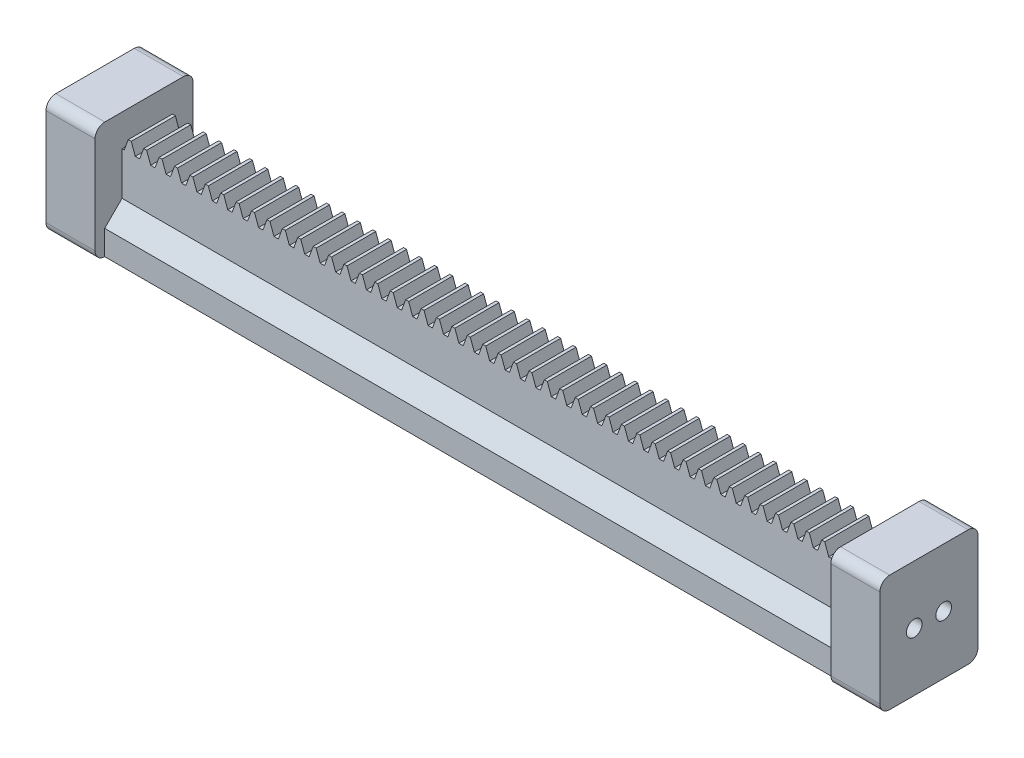
from build123d import *

# Parameters (mm, degrees)
BLANKSKE_W          = 150
BLANKSKE_H          = 11
BLANK_DEPTH         = 9
TOOTHCUTSIM_DEPTH   = 151.67182882
TEETHCUTS_COUNT     = 49
TEETHCUTS_PITCH     = 3.14159265
BOSS_EXTRUDE4_DEPTH = 150
BOSS_EXTRUDE5_DEPTH = 10
SKETCH6_R           = 1.6
CUT_EXTRUDE1_DEPTH  = 10


with BuildPart() as part:
    # BlankSke → Blank (new body)
    with BuildSketch(Plane.XY):
        with Locations((75, 5.5)):
            Rectangle(BLANKSKE_W, BLANKSKE_H)
    extrude(amount=-BLANK_DEPTH)

    # TooCutSkeSim → ToothCutSim (cut, through all)
    with BuildSketch(Plane.XY):
        Polygon((0.44443537, 8.75), (-0.44443537, 8.75), (-1.272613241, 11.0254), (1.272613241, 11.0254), align=None)
    toothcutsim = extrude(amount=-TOOTHCUTSIM_DEPTH, mode=Mode.SUBTRACT)

    # TeethCuts: ToothCutSim ×49
    with Locations(*[(i * TEETHCUTS_PITCH, 0, 0) for i in range(1, TEETHCUTS_COUNT)]):
        add(toothcutsim, mode=Mode.SUBTRACT)

    # Sketch4 → Boss-Extrude4 (add, through all)
    with BuildSketch(Plane(origin=(150, 0, 0), x_dir=(0, 0, -1), z_dir=(1, 0, 0))):
        Polygon((0, 0), (-3.535533906, -3.535533906), (-3.535533906, -8.535533906), (12.535533906, -8.535533906), (12.535533906, -3.535533906), (9, 0), align=None)
    extrude(amount=-BOSS_EXTRUDE4_DEPTH)

    # Sketch5 → Boss-Extrude5 (add)
    with BuildSketch(Plane(origin=(150, 0, 0), x_dir=(0, 0, -1), z_dir=(1, 0, 0))):
        with BuildLine():
            Line((12.5, -8.535533906), (-3.5, -8.535533906))
            ThreePointArc((-3.5, -8.535533906), (-4.914213562, -7.949747468), (-5.5, -6.535533906))
            Line((-5.5, -6.535533906), (-5.5, 13.232233047))
            ThreePointArc((-5.5, 13.232233047), (-4.914213562, 14.646446609), (-3.5, 15.232233047))
            Line((-3.5, 15.232233047), (12.5, 15.232233047))
            ThreePointArc((12.5, 15.232233047), (13.914213562, 14.646446609), (14.5, 13.232233047))
            Line((14.5, 13.232233047), (14.5, -6.535533906))
            ThreePointArc((14.5, -6.535533906), (13.914213562, -7.949747468), (12.5, -8.535533906))
        make_face()
    boss_extrude5 = extrude(amount=BOSS_EXTRUDE5_DEPTH)

    # Mirror2: Boss-Extrude5 across plane
    add(boss_extrude5.mirror(Plane(origin=(75, 0, 0), x_dir=(0, 0, 1), z_dir=(1, 0, 0))))

    # Sketch6 → Cut-Extrude1 (cut)
    with BuildSketch(Plane(origin=(160, 0, 0), x_dir=(0, 0, -1), z_dir=(1, 0, 0))):
        with Locations((1.5, 3.348349571)):
            Circle(SKETCH6_R)
        with Locations((7.5, 3.348349571)):
            Circle(SKETCH6_R)
    extrude(amount=-CUT_EXTRUDE1_DEPTH, mode=Mode.SUBTRACT)


with BuildPart() as body_2:
    # Split1: the piece on the far side of the plane
    add(part.part)
    split(bisect_by=Plane(origin=(0, 0, 0), x_dir=(0, 0, 1), z_dir=(1, 0, 0)), keep=Keep.BOTTOM)


with BuildPart() as part_1:
    add(part.part)

    # Split1
    split(bisect_by=Plane(origin=(0, 0, 0), x_dir=(0, 0, 1), z_dir=(1, 0, 0)), keep=Keep.TOP)


solid = Compound([body_2.part, part_1.part])
